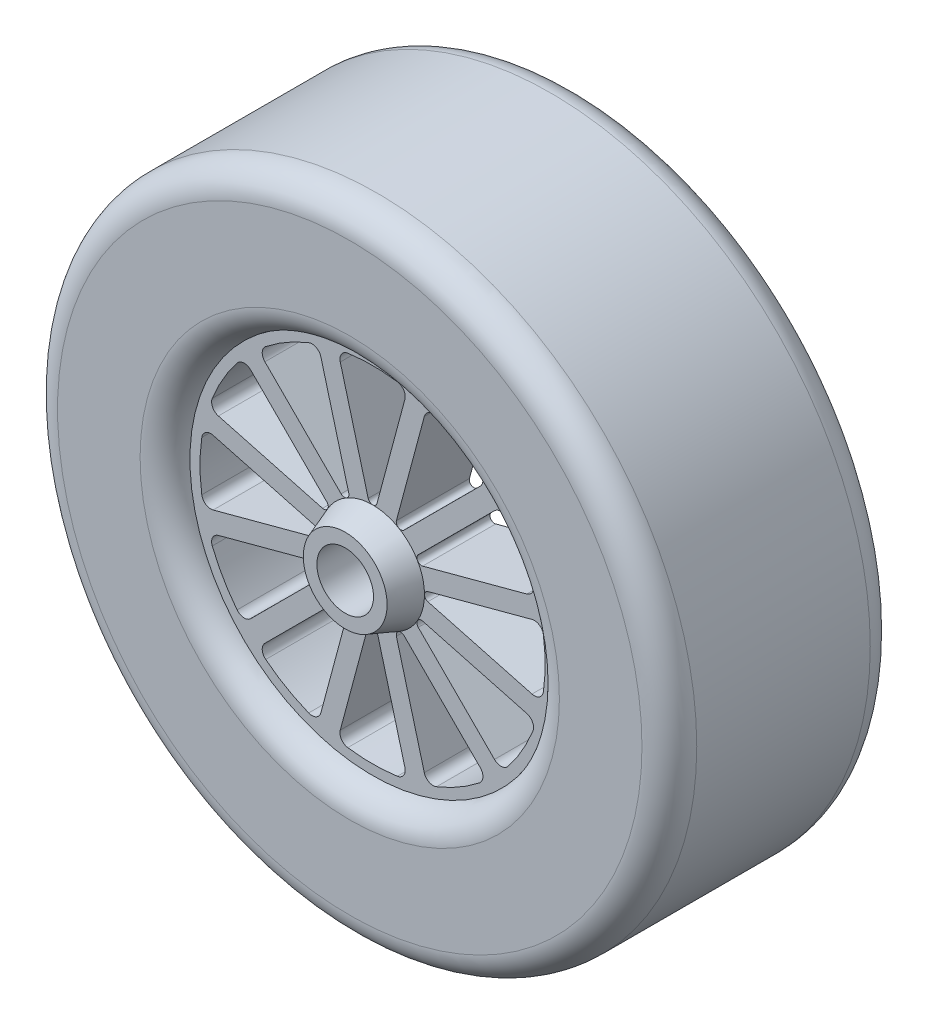
from build123d import *

# Parameters (mm, degrees)
SKETCH_1_R          = 35
EXTRUDE_1_DEPTH     = 12.5
SKETCH_2_R          = 3.05
CUT_EXTRUDE_1_DEPTH = 50
SKETCH_3_R          = 20
SKETCH_3_R_2        = 5
CUT_EXTRUDE_2_DEPTH = 2.5
SKETCH_5_R          = 5
CUT_EXTRUDE_4_DEPTH = 2.5
FILLET_1_R          = 3
CUT_EXTRUDE_5_DEPTH = 55.371407927
SKETCH_8_R          = 5.681925288
EXTRUDE_2_DEPTH     = 3
EXTRUDE_2_TAPER     = 20
SKETCH_9_R          = 3.1
CUT_EXTRUDE_6_DEPTH = 56.679888649


with BuildPart() as part:
    # 草图1 → 凸台-拉伸1 (new, symmetric)
    with BuildSketch(Plane.XY):
        Circle(SKETCH_1_R)
    extrude(amount=EXTRUDE_1_DEPTH, both=True)

    # 草图2 → 切除-拉伸1 (cut)
    with BuildSketch(Plane.XY.offset(12.5)):
        Circle(SKETCH_2_R)
    extrude(amount=-CUT_EXTRUDE_1_DEPTH, mode=Mode.SUBTRACT)

    # 草图3 → 切除-拉伸2 (cut)
    with BuildSketch(Plane.XY.offset(12.5)):
        Circle(SKETCH_3_R)
        Circle(SKETCH_3_R_2, mode=Mode.SUBTRACT)
    cut_extrude_2 = extrude(amount=-CUT_EXTRUDE_2_DEPTH, mode=Mode.SUBTRACT)

    # 镜向1: 切除-拉伸2 across plane
    add(cut_extrude_2.mirror(Plane.XY), mode=Mode.SUBTRACT)

    # 草图5 → 切除-拉伸4 (cut)
    with BuildSketch(Plane(origin=(0, 0, -12.5), x_dir=(-1, 0, 0), z_dir=(0, 0, -1))):
        with Locations(Location((0, 0, 0), (0, 0, 180))):
            Circle(SKETCH_5_R)
    cut_extrude_4 = extrude(amount=-CUT_EXTRUDE_4_DEPTH, mode=Mode.SUBTRACT)

    # 镜向2: 切除-拉伸4 across plane
    add(cut_extrude_4.mirror(Plane.XY), mode=Mode.SUBTRACT)

    # 圆角1
    # the kernel refuses this fillet: 3 mm, written as the material it takes off along each edge
    with BuildSketch(Plane(origin=(0, 0, 12.5), x_dir=(1, 0, 0), z_dir=(0, -1, 0))) as fillet_1_piece_1:
        with BuildLine():
            CenterArc((22.958039892, -3), FILLET_1_R, 90, 80.405931773)
            Line((20, -2.5), (19.940839202, -2.49))
            ThreePointArc((19.940839202, -2.49), (19.94, -1.25), (19.94, 0))
            Line((19.94, 0), (20, 0.06))
            Line((20, 0.06), (22.958039892, 0.06))
            Line((22.958039892, 0.06), (22.958039892, 0))
        make_face()
    revolve(axis=Axis((0, 0, 12.5), (0, 0, 1)), mode=Mode.SUBTRACT)
    with BuildSketch(Plane(origin=(0, 0, -12.5), x_dir=(1, 0, 0), z_dir=(0, -1, 0))) as fillet_1_piece_2:
        with BuildLine():
            CenterArc((35 - FILLET_1_R, FILLET_1_R), FILLET_1_R, 270, 90)
            Line((35 - FILLET_1_R, 0), (35 - FILLET_1_R, -FILLET_1_R * 0.02))
            Line((35 - FILLET_1_R, -FILLET_1_R * 0.02), (35 + FILLET_1_R * 0.02, -FILLET_1_R * 0.02))
            Line((35 + FILLET_1_R * 0.02, -FILLET_1_R * 0.02), (35 + FILLET_1_R * 0.02, FILLET_1_R))
            Line((35 + FILLET_1_R * 0.02, FILLET_1_R), (35, FILLET_1_R))
        make_face()
    revolve(axis=Axis((0, 0, -12.5), (0, 0, 1)), mode=Mode.SUBTRACT)
    with BuildSketch(Plane(origin=(0, 0, -12.5), x_dir=(1, 0, 0), z_dir=(0, -1, 0))) as fillet_1_piece_3:
        with BuildLine():
            CenterArc((22.958039892, 3), FILLET_1_R, 189.594068227, 80.405931773)
            Line((20, 2.5), (19.940839202, 2.49))
            ThreePointArc((19.940839202, 2.49), (19.94, 1.25), (19.94, 0))
            Line((19.94, 0), (20, -0.06))
            Line((20, -0.06), (22.958039892, -0.06))
            Line((22.958039892, -0.06), (22.958039892, 0))
        make_face()
    revolve(axis=Axis((0, 0, -12.5), (0, 0, 1)), mode=Mode.SUBTRACT)
    with BuildSketch(Plane(origin=(0, 0, 12.5), x_dir=(1, 0, 0), z_dir=(0, -1, 0))) as fillet_1_piece_4:
        with BuildLine():
            CenterArc((35 - FILLET_1_R, -FILLET_1_R), FILLET_1_R, 0, 90)
            Line((35 - FILLET_1_R, 0), (35 - FILLET_1_R, FILLET_1_R * 0.02))
            Line((35 - FILLET_1_R, FILLET_1_R * 0.02), (35 + FILLET_1_R * 0.02, FILLET_1_R * 0.02))
            Line((35 + FILLET_1_R * 0.02, FILLET_1_R * 0.02), (35 + FILLET_1_R * 0.02, -FILLET_1_R))
            Line((35 + FILLET_1_R * 0.02, -FILLET_1_R), (35, -FILLET_1_R))
        make_face()
    revolve(axis=Axis((0, 0, 12.5), (0, 0, 1)), mode=Mode.SUBTRACT)

    # 草图6 → 切除-拉伸5 (cut, through all)
    with BuildSketch(Plane.XY.offset(10)):
        with BuildLine():
            Line((-0.482962913, 6.052515766), (-3.538349575, 17.455374023))
            ThreePointArc((-3.538349575, 17.455374023), (-3.407572366, 18.264217418), (-2.716134572, 18.703812793))
            ThreePointArc((-2.716134572, 18.703812793), (0, 18.9), (2.716134572, 18.703812793))
            ThreePointArc((2.716134572, 18.703812793), (3.407572366, 18.264217418), (3.538349575, 17.455374023))
            Line((3.538349575, 17.455374023), (0.482962913, 6.052515766))
            ThreePointArc((0.482962913, 6.052515766), (0, 5.681925288), (-0.482962913, 6.052515766))
        make_face()
        with BuildLine():
            Line((3.444516035, 5.000150953), (11.791987631, 13.347622549))
            ThreePointArc((11.791987631, 13.347622549), (12.083152944, 14.113490081), (11.704147936, 14.83990974))
            ThreePointArc((11.704147936, 14.83990974), (9.45, 16.367880132), (6.999664857, 17.556044312))
            ThreePointArc((6.999664857, 17.556044312), (6.181064475, 17.521062448), (5.663386392, 16.885972124))
            Line((5.663386392, 16.885972124), (2.607999731, 5.483113866))
            ThreePointArc((2.607999731, 5.483113866), (2.840962644, 4.920691642), (3.444516035, 5.000150953))
        make_face()
        with BuildLine():
            Line((5.483113866, 2.607999731), (16.885972124, 5.663386392))
            ThreePointArc((16.885972124, 5.663386392), (17.521062448, 6.181064475), (17.556044312, 6.999664857))
            ThreePointArc((17.556044312, 6.999664857), (16.367880132, 9.45), (14.83990974, 11.704147936))
            ThreePointArc((14.83990974, 11.704147936), (14.113490081, 12.083152944), (13.347622549, 11.791987631))
            Line((13.347622549, 11.791987631), (5.000150953, 3.444516035))
            ThreePointArc((5.000150953, 3.444516035), (4.920691642, 2.840962644), (5.483113866, 2.607999731))
        make_face()
        with BuildLine():
            Line((6.052515766, -0.482962913), (17.455374023, -3.538349575))
            ThreePointArc((17.455374023, -3.538349575), (18.264217418, -3.407572366), (18.703812793, -2.716134572))
            ThreePointArc((18.703812793, -2.716134572), (18.9, 0), (18.703812793, 2.716134572))
            ThreePointArc((18.703812793, 2.716134572), (18.264217418, 3.407572366), (17.455374023, 3.538349575))
            Line((17.455374023, 3.538349575), (6.052515766, 0.482962913))
            ThreePointArc((6.052515766, 0.482962913), (5.681925288, 0), (6.052515766, -0.482962913))
        make_face()
        with BuildLine():
            Line((5.000150953, -3.444516035), (13.347622549, -11.791987631))
            ThreePointArc((13.347622549, -11.791987631), (14.113490081, -12.083152944), (14.83990974, -11.704147936))
            ThreePointArc((14.83990974, -11.704147936), (16.367880132, -9.45), (17.556044312, -6.999664857))
            ThreePointArc((17.556044312, -6.999664857), (17.521062448, -6.181064475), (16.885972124, -5.663386392))
            Line((16.885972124, -5.663386392), (5.483113866, -2.607999731))
            ThreePointArc((5.483113866, -2.607999731), (4.920691642, -2.840962644), (5.000150953, -3.444516035))
        make_face()
        with BuildLine():
            Line((2.607999731, -5.483113866), (5.663386392, -16.885972124))
            ThreePointArc((5.663386392, -16.885972124), (6.181064475, -17.521062448), (6.999664857, -17.556044312))
            ThreePointArc((6.999664857, -17.556044312), (9.45, -16.367880132), (11.704147936, -14.83990974))
            ThreePointArc((11.704147936, -14.83990974), (12.083152944, -14.113490081), (11.791987631, -13.347622549))
            Line((11.791987631, -13.347622549), (3.444516035, -5.000150953))
            ThreePointArc((3.444516035, -5.000150953), (2.840962644, -4.920691642), (2.607999731, -5.483113866))
        make_face()
        with BuildLine():
            Line((-0.482962913, -6.052515766), (-3.538349575, -17.455374023))
            ThreePointArc((-3.538349575, -17.455374023), (-3.407572366, -18.264217418), (-2.716134572, -18.703812793))
            ThreePointArc((-2.716134572, -18.703812793), (0, -18.9), (2.716134572, -18.703812793))
            ThreePointArc((2.716134572, -18.703812793), (3.407572366, -18.264217418), (3.538349575, -17.455374023))
            Line((3.538349575, -17.455374023), (0.482962913, -6.052515766))
            ThreePointArc((0.482962913, -6.052515766), (0, -5.681925288), (-0.482962913, -6.052515766))
        make_face()
        with BuildLine():
            Line((-3.444516035, -5.000150953), (-11.791987631, -13.347622549))
            ThreePointArc((-11.791987631, -13.347622549), (-12.083152944, -14.113490081), (-11.704147936, -14.83990974))
            ThreePointArc((-11.704147936, -14.83990974), (-9.45, -16.367880132), (-6.999664857, -17.556044312))
            ThreePointArc((-6.999664857, -17.556044312), (-6.181064475, -17.521062448), (-5.663386392, -16.885972124))
            Line((-5.663386392, -16.885972124), (-2.607999731, -5.483113866))
            ThreePointArc((-2.607999731, -5.483113866), (-2.840962644, -4.920691642), (-3.444516035, -5.000150953))
        make_face()
        with BuildLine():
            Line((-5.483113866, -2.607999731), (-16.885972124, -5.663386392))
            ThreePointArc((-16.885972124, -5.663386392), (-17.521062448, -6.181064475), (-17.556044312, -6.999664857))
            ThreePointArc((-17.556044312, -6.999664857), (-16.367880132, -9.45), (-14.83990974, -11.704147936))
            ThreePointArc((-14.83990974, -11.704147936), (-14.113490081, -12.083152944), (-13.347622549, -11.791987631))
            Line((-13.347622549, -11.791987631), (-5.000150953, -3.444516035))
            ThreePointArc((-5.000150953, -3.444516035), (-4.920691642, -2.840962644), (-5.483113866, -2.607999731))
        make_face()
        with BuildLine():
            Line((-6.052515766, 0.482962913), (-17.455374023, 3.538349575))
            ThreePointArc((-17.455374023, 3.538349575), (-18.264217418, 3.407572366), (-18.703812793, 2.716134572))
            ThreePointArc((-18.703812793, 2.716134572), (-18.9, 0), (-18.703812793, -2.716134572))
            ThreePointArc((-18.703812793, -2.716134572), (-18.264217418, -3.407572366), (-17.455374023, -3.538349575))
            Line((-17.455374023, -3.538349575), (-6.052515766, -0.482962913))
            ThreePointArc((-6.052515766, -0.482962913), (-5.681925288, 0), (-6.052515766, 0.482962913))
        make_face()
        with BuildLine():
            Line((-5.000150953, 3.444516035), (-13.347622549, 11.791987631))
            ThreePointArc((-13.347622549, 11.791987631), (-14.113490081, 12.083152944), (-14.83990974, 11.704147936))
            ThreePointArc((-14.83990974, 11.704147936), (-16.367880132, 9.45), (-17.556044312, 6.999664857))
            ThreePointArc((-17.556044312, 6.999664857), (-17.521062448, 6.181064475), (-16.885972124, 5.663386392))
            Line((-16.885972124, 5.663386392), (-5.483113866, 2.607999731))
            ThreePointArc((-5.483113866, 2.607999731), (-4.920691642, 2.840962644), (-5.000150953, 3.444516035))
        make_face()
        with BuildLine():
            Line((-2.607999731, 5.483113866), (-5.663386392, 16.885972124))
            ThreePointArc((-5.663386392, 16.885972124), (-6.181064475, 17.521062448), (-6.999664857, 17.556044312))
            ThreePointArc((-6.999664857, 17.556044312), (-9.45, 16.367880132), (-11.704147936, 14.83990974))
            ThreePointArc((-11.704147936, 14.83990974), (-12.083152944, 14.113490081), (-11.791987631, 13.347622549))
            Line((-11.791987631, 13.347622549), (-3.444516035, 5.000150953))
            ThreePointArc((-3.444516035, 5.000150953), (-2.840962644, 4.920691642), (-2.607999731, 5.483113866))
        make_face()
    extrude(amount=-CUT_EXTRUDE_5_DEPTH, mode=Mode.SUBTRACT)

    # 草图7 → 切除-旋转1 (revolve, cut)
    with BuildSketch(Plane(origin=(0, 0, 0), x_dir=(1, 0, 0), z_dir=(0, 1, 0)), mode=Mode.PRIVATE) as cut_revolve_1_sk:
        with BuildLine():
            Line((-10.299846334, -1.6401844), (-20, 10))
            Line((-20, 10), (0, 10))
            Line((0, 10), (0, -2))
            Line((0, -2), (-9.531625054, -2))
            ThreePointArc((-9.531625054, -2), (-9.95578045, -1.905589421), (-10.299846334, -1.6401844))
        make_face()
    revolve(cut_revolve_1_sk.sketch.rotate(Axis((0, 0, 0), (0, 0, -1)), 180), axis=Axis((0, 0, 0), (0, 0, -1)), mode=Mode.SUBTRACT)

    # 草图8 → 凸台-拉伸2 (add)
    with BuildSketch(Plane.XY.offset(10)):
        Circle(SKETCH_8_R)
    extrude(amount=EXTRUDE_2_DEPTH, taper=EXTRUDE_2_TAPER)

    # 草图9 → 切除-拉伸6 (cut, through all)
    with BuildSketch(Plane.XY.offset(13)):
        Circle(SKETCH_9_R)
    extrude(amount=-CUT_EXTRUDE_6_DEPTH, mode=Mode.SUBTRACT)


solid = part.part
